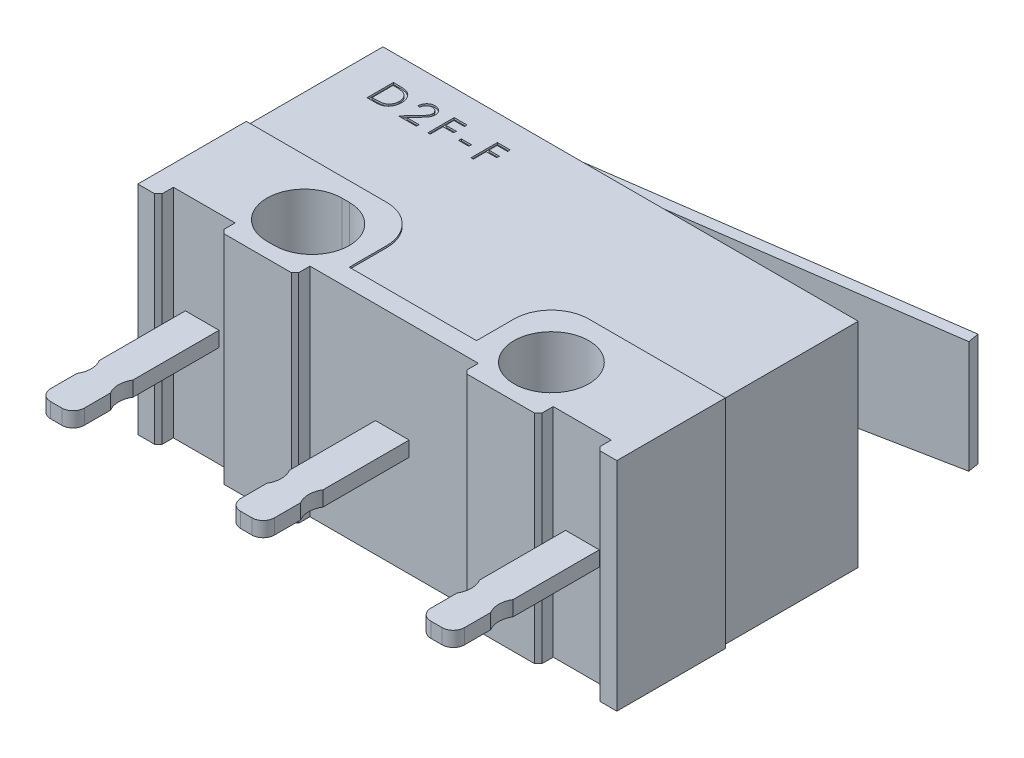
from build123d import *

# Parameters (mm, degrees)
SKETCH1_W                = 12.7
SKETCH1_H                = 6.1
BASE_EXTRUDE_DEPTH       = 5.7
SKETCH2_R                = 1
CUT_EXTRUDE1_DEPTH       = 16.198355174
BOSS_EXTRUDE1_START      = 0.05
SKETCH3_R                = 1
BOSS_EXTRUDE1_DEPTH      = 0.05
SKETCH4_R                = 1
BOSS_EXTRUDE2_DEPTH      = 0.05
SKETCH13_W               = 1.2
SKETCH13_H               = 2.9
EXTRUDE1_DEPTH           = 0.5
FILLET1_R                = 0.599
SKETCH6_W                = 0.9
SKETCH6_H                = 0.4
BOSS_EXTRUDE4_DEPTH      = 3.9
CUT_EXTRUDE4_DEPTH       = 15.644452875
FILLET2_R                = 0.3
SKETCH8_W                = 0.5
SKETCH8_H                = 5.8
SKETCH8_W_2              = 2
BOSS_EXTRUDE5_DEPTH      = 0.4
CHAMFER3_SIZE            = 0.1
BOSS_EXTRUDE6_DEPTH      = 1.8
BOSS_EXTRUDE6_DEPTH_BACK = 1.8
CUT_EXTRUDE5_DEPTH       = 18.718764616
SKETCH12_W               = 0.271367521
SKETCH12_H               = 0.072364672
CUT_EXTRUDE3_DEPTH       = 0.05
SKETCH16_W               = 2.901
SKETCH16_H               = 5.8
EXTRUDE2_DEPTH           = 0.05
SKETCH17_W               = 2.901
SKETCH17_H               = 5.8
EXTRUDE3_DEPTH           = 0.05
CUT_EXTRUDE6_DEPTH       = 0.3


with BuildPart() as part:
    # Sketch1 → Base-Extrude (new body)
    with BuildSketch(Plane(origin=(0, 0, 0), x_dir=(1, 0, 0), z_dir=(0, 1, 0))):
        with Locations((6.35, 3.05)):
            Rectangle(SKETCH1_W, SKETCH1_H)
    extrude(amount=BASE_EXTRUDE_DEPTH)

    # Sketch2 → Cut-Extrude1 (cut, through all)
    with BuildSketch(Plane(origin=(0, 5.7, 0), x_dir=(-1, 0, 0), z_dir=(0, 1, 0))):
        with Locations(Location((-9.6, -1.001, 0), (0, 0, 90))):
            Circle(SKETCH2_R)
        with BuildLine():
            Line((-3, -2.001), (-3.2, -2.001))
            ThreePointArc((-3.2, -2.001), (-4.2, -1.001), (-3.2, -0.001))
            Line((-3.2, -0.001), (-3, -0.001))
            ThreePointArc((-3, -0.001), (-2, -1.001), (-3, -2.001))
        make_face()
    extrude(amount=-CUT_EXTRUDE1_DEPTH, mode=Mode.SUBTRACT)

    # Sketch3 → Boss-Extrude1 (add)
    with BuildSketch(Plane(origin=(0, 5.7, 0), x_dir=(-1, 0, 0), z_dir=(0, 1, 0)).offset(BOSS_EXTRUDE1_START)):
        with BuildLine():
            Line((-12.7, -2.501), (-9.1, -2.501))
            ThreePointArc((-9.1, -2.501), (-8.392893219, -2.208106781), (-8.1, -1.501))
            Line((-8.1, -1.501), (-8.1, -0.5))
            Line((-8.1, -0.5), (-4.7, -0.5))
            Line((-4.7, -0.5), (-4.7, -1.501))
            ThreePointArc((-4.7, -1.501), (-4.407106781, -2.208106781), (-3.7, -2.501))
            Line((-3.7, -2.501), (0, -2.501))
            Line((0, -2.501), (0, 0))
            Line((0, 0), (-12.7, 0))
            Line((-12.7, 0), (-12.7, -2.501))
        make_face()
        with Locations(Location((-9.6, -1.001, 0), (0, 0, 90))):
            Circle(SKETCH3_R, mode=Mode.SUBTRACT)
        with BuildLine():
            Line((-3, -0.001), (-3.2, -0.001))
            ThreePointArc((-3.2, -0.001), (-4.2, -1.001), (-3.2, -2.001))
            Line((-3.2, -2.001), (-3, -2.001))
            ThreePointArc((-3, -2.001), (-2, -1.001), (-3, -0.001))
        make_face(mode=Mode.SUBTRACT)
    extrude(amount=-BOSS_EXTRUDE1_DEPTH)

    # Sketch4 → Boss-Extrude2 (add)
    with BuildSketch(Plane.XZ):
        with BuildLine():
            Line((12.7, -2.501), (12.7, 0))
            Line((12.7, 0), (0, 0))
            Line((0, 0), (0, -2.501))
            Line((0, -2.501), (3.7, -2.501))
            ThreePointArc((3.7, -2.501), (4.407106781, -2.208106781), (4.7, -1.501))
            Line((4.7, -1.501), (4.7, -0.5))
            Line((4.7, -0.5), (8.1, -0.5))
            Line((8.1, -0.5), (8.1, -1.501))
            ThreePointArc((8.1, -1.501), (8.392893219, -2.208106781), (9.1, -2.501))
            Line((9.1, -2.501), (12.7, -2.501))
        make_face()
        with Locations(Location((9.6, -1.001, 0), (0, 0, 90))):
            Circle(SKETCH4_R, mode=Mode.SUBTRACT)
        with BuildLine():
            Line((3, -0.001), (3.2, -0.001))
            ThreePointArc((3.2, -0.001), (4.2, -1.001), (3.2, -2.001))
            Line((3.2, -2.001), (3, -2.001))
            ThreePointArc((3, -2.001), (2, -1.001), (3, -0.001))
        make_face(mode=Mode.SUBTRACT)
    extrude(amount=BOSS_EXTRUDE2_DEPTH)

    # Sketch13 → Extrude1 (add)
    with BuildSketch(Plane(origin=(0, 0, -6.1), x_dir=(-1, 0, 0), z_dir=(0, 0, -1))):
        with Locations((-4.4, 2.85)):
            Rectangle(SKETCH13_W, SKETCH13_H)
    extrude(amount=EXTRUDE1_DEPTH)

    # Fillet1
    # the kernel refuses this fillet: 0.599 mm, written as the material it takes off along each edge
    with BuildSketch(Plane(origin=(3.8, 5.776905549, -6.6), x_dir=(0, 0, 1), z_dir=(0, -1, 0)), Plane(origin=(5, -0.076905549, -6.6), x_dir=(0, 0, 1), z_dir=(0, 1, 0))) as fillet1_piece_1:
        with BuildLine():
            CenterArc((0.599, -0.59076222), FILLET1_R, 99.513236816, 80.486763184)
            Line((0, -0.59076222), (-0.01198, -0.59076222))
            Line((-0.01198, -0.59076222), (-0.01198, 0))
            Line((-0.01198, 0), (0, 0.01198))
            ThreePointArc((0, 0.01198), (0.25, 0.01198), (0.49802, 0.011815244))
            Line((0.49802, 0.011815244), (0.5, 0))
        make_face()
    extrude(amount=5.853811098, mode=Mode.SUBTRACT)

    # Sketch6 → Boss-Extrude4 (add)
    with BuildSketch(Plane.XY):
        with Locations((1.27, 2.85)):
            Rectangle(SKETCH6_W, SKETCH6_H)
        with Locations((6.35, 2.85)):
            Rectangle(SKETCH6_W, SKETCH6_H)
        with Locations((11.43, 2.85)):
            Rectangle(SKETCH6_W, SKETCH6_H)
    extrude(amount=BOSS_EXTRUDE4_DEPTH)

    # Sketch14 → Cut-Extrude4 (cut, through all)
    with BuildSketch(Plane(origin=(0, 3.05, 0), x_dir=(-1, 0, 0), z_dir=(0, 1, 0))):
        with BuildLine():
            Line((-6.8, 2.3), (-6.8, 2.9))
            ThreePointArc((-6.8, 2.9), (-6.716904811, 2.6), (-6.8, 2.3))
        make_face()
        with BuildLine():
            Line((-5.9, 2.3), (-5.9, 2.9))
            ThreePointArc((-5.9, 2.9), (-5.983095189, 2.6), (-5.9, 2.3))
        make_face()
        with BuildLine():
            Line((-1.72, 2.3), (-1.72, 2.9))
            ThreePointArc((-1.72, 2.9), (-1.636904811, 2.6), (-1.72, 2.3))
        make_face()
        with BuildLine():
            Line((-0.82, 2.3), (-0.82, 2.9))
            ThreePointArc((-0.82, 2.9), (-0.903095189, 2.6), (-0.82, 2.3))
        make_face()
        with BuildLine():
            Line((-11.88, 2.3), (-11.88, 2.9))
            ThreePointArc((-11.88, 2.9), (-11.796904811, 2.6), (-11.88, 2.3))
        make_face()
        with BuildLine():
            Line((-10.98, 2.3), (-10.98, 2.9))
            ThreePointArc((-10.98, 2.9), (-11.063095189, 2.6), (-10.98, 2.3))
        make_face()
    extrude(amount=-CUT_EXTRUDE4_DEPTH, mode=Mode.SUBTRACT)

    # Fillet2
    fillet2_edges = [part.edges().sort_by_distance(p)[0] for p in [
        (0.82, 2.85, 3.9),
        (1.72, 2.85, 3.9),
        (5.9, 2.85, 3.9),
        (6.8, 2.85, 3.9),
        (10.98, 2.85, 3.9),
        (11.88, 2.85, 3.9),
    ]]
    fillet(fillet2_edges, radius=FILLET2_R)

    # Sketch8 → Boss-Extrude5 (add)
    with BuildSketch(Plane.XY):
        with Locations((12.45, 2.85)):
            Rectangle(SKETCH8_W, SKETCH8_H)
        with Locations((0.25, 2.85)):
            Rectangle(SKETCH8_W, SKETCH8_H)
        with Locations((3.15, 2.85)):
            Rectangle(SKETCH8_W_2, SKETCH8_H)
        with Locations((9.65, 2.85)):
            Rectangle(SKETCH8_W_2, SKETCH8_H)
    extrude(amount=BOSS_EXTRUDE5_DEPTH)

    # Chamfer3
    chamfer3_edges = [part.edges().sort_by_distance(p)[0] for p in [
        (0.5, 2.85, 0.4),
        (12.2, 2.85, 0.4),
        (2.15, 2.85, 0.4),
        (4.15, 2.85, 0.4),
        (8.65, 2.85, 0.4),
        (10.65, 2.85, 0.4),
    ]]
    chamfer(chamfer3_edges, length=CHAMFER3_SIZE)

    # Sketch11 → Boss-Extrude6 (add, two sides: drawn at the far end of the back side and taken through both)
    with BuildSketch(Plane(origin=(0, 3, 0), x_dir=(-1, 0, 0), z_dir=(0, 1, 0)).offset(-BOSS_EXTRUDE6_DEPTH_BACK)):
        with BuildLine():
            Line((-13.4, -8.6), (-1.150385897, -6.545868959))
            ThreePointArc((-1.150385897, -6.545868959), (-0.970997565, -6.443798567), (-0.9, -6.25))
            Line((-0.9, -6.25), (-0.9, -6.1))
            Line((-0.9, -6.1), (-1.2, -6.1))
            Line((-1.2, -6.1), (-1.2, -6.165372705))
            ThreePointArc((-1.2, -6.165372705), (-1.223665855, -6.229972227), (-1.283461966, -6.263995691))
            Line((-1.283461966, -6.263995691), (-13.449614103, -8.304131041))
            Line((-13.449614103, -8.304131041), (-13.4, -8.6))
        make_face()
    extrude(amount=BOSS_EXTRUDE6_DEPTH + BOSS_EXTRUDE6_DEPTH_BACK)

    # Sketch15 → Cut-Extrude5 (cut, through all)
    with BuildSketch(Plane(origin=(0, 0, -6.1), x_dir=(-1, 0, 0), z_dir=(0, 0, -1))):
        Polygon((-0.9, 1.2), (-13.449614103, 1.2), (-13.449614103, 1.5), align=None)
        Polygon((-13.449614103, 4.5), (-13.449614103, 4.8), (-0.9, 4.8), align=None)
    extrude(amount=CUT_EXTRUDE5_DEPTH, mode=Mode.SUBTRACT)

    # Sketch12 → Cut-Extrude3 (cut)
    # profile 1 of 5: a face of its own
    with BuildSketch(Plane(origin=(-12.497117176, 5.7, -3.291404599), x_dir=(1, 0, 0), z_dir=(0, 1, 0))):
        with BuildLine():
            Line((13.462569321, 1.417389307), (13.462569321, 2.122944862))
            Line((13.462569321, 2.122944862), (13.60503727, 2.122944862))
            add(Edge.make_bspline(
                [(13.60503727, 2.122944862), (13.617428637, 2.122855646), (13.641368695, 2.12268328), (13.675963585, 2.121590397), (13.707972375, 2.11965708), (13.737289793, 2.116841001), (13.763996323, 2.113383168), (13.788017185, 2.109048959), (13.809476585, 2.103931026), (13.822674393, 2.099567578), (13.828915475, 2.097504157)],
                knots=[0, 0, 0, 0, 1.314313732, 2.53924729, 3.670748893, 4.714932338, 5.66265055, 6.526160246, 7.303039223, 8, 8, 8, 8], degree=3))
            add(Edge.make_bspline(
                [(13.828915475, 2.097504157), (13.8370787, 2.094393523), (13.853220036, 2.088242793), (13.876202424, 2.076640174), (13.897837854, 2.063494041), (13.918242349, 2.048787065), (13.936949817, 2.032102823), (13.954691091, 2.014150046), (13.970740409, 1.994275888), (13.985437795, 1.972892518), (13.998689269, 1.950251834), (14.010207798, 1.926396979), (14.019773921, 1.901449097), (14.027715095, 1.875477568), (14.033973666, 1.848425282), (14.038243675, 1.820260741), (14.041060049, 1.791095253), (14.041343088, 1.771304528), (14.0414867, 1.761262838)],
                knots=[0, 0, 0, 0, 0.984719456, 1.947108742, 2.898477687, 3.838006223, 4.779231079, 5.722358779, 6.681677486, 7.655904652, 8.64651281, 9.637519902, 10.640069247, 11.656948941, 12.698408672, 13.768548281, 14.867775369, 16, 16, 16, 16], degree=3))
            add(Edge.make_bspline(
                [(14.0414867, 1.761262838), (14.041359908, 1.752541922), (14.041110052, 1.735356445), (14.038866523, 1.710028836), (14.035605582, 1.685452608), (14.03055699, 1.661744792), (14.024428229, 1.638697675), (14.016573551, 1.61655689), (14.007575602, 1.595119328), (13.997083007, 1.574674853), (13.98556403, 1.555305665), (13.973202345, 1.537046789), (13.960011138, 1.520158768), (13.945864622, 1.50459046), (13.930945606, 1.490365336), (13.915156415, 1.477364564), (13.898456308, 1.465842529), (13.880920083, 1.455346461), (13.862036165, 1.446190294), (13.841446871, 1.438443292), (13.819064396, 1.432023419), (13.794943678, 1.426667064), (13.76904304, 1.422418147), (13.74133709, 1.419570446), (13.711868395, 1.417644696), (13.69163321, 1.417476089), (13.681218048, 1.417389307)],
                knots=[0, 0, 0, 0, 1.105936401, 2.179363191, 3.223086493, 4.248585256, 5.251745608, 6.245858792, 7.225916811, 8.198733463, 9.158002045, 10.082870192, 10.993790845, 11.873723703, 12.748670949, 13.606408763, 14.465103618, 15.319838547, 16.196477973, 17.123216899, 18.106603292, 19.147568657, 20.255746949, 21.433717677, 22.679120308, 24, 24, 24, 24], degree=3))
            Line((13.681218048, 1.417389307), (13.462569321, 1.417389307))
        make_face()
        with BuildLine():
            Line((13.525888409, 1.489753979), (13.606874654, 1.489753979))
            add(Edge.make_bspline(
                [(13.606874654, 1.489753979), (13.618511961, 1.489803992), (13.640894763, 1.489900186), (13.673079788, 1.490744273), (13.702487222, 1.492123521), (13.72912124, 1.494053735), (13.752966805, 1.496607567), (13.774073752, 1.499454968), (13.792372891, 1.50300239), (13.803445968, 1.506217901), (13.808562911, 1.50770381)],
                knots=[0, 0, 0, 0, 1.375205317, 2.645023457, 3.804390687, 4.853969522, 5.800190428, 6.637939096, 7.370582563, 8, 8, 8, 8], degree=3))
            add(Edge.make_bspline(
                [(13.808562911, 1.50770381), (13.815003295, 1.509971981), (13.827730235, 1.514454149), (13.846050708, 1.522630058), (13.863136643, 1.532314729), (13.879285807, 1.54307995), (13.894269117, 1.555305414), (13.908264137, 1.56872528), (13.921242691, 1.583407845), (13.933070686, 1.599334887), (13.943655694, 1.616407275), (13.952822116, 1.634457167), (13.960855679, 1.653286793), (13.967161046, 1.673185306), (13.972103076, 1.693974815), (13.975603577, 1.715656782), (13.977783688, 1.738227158), (13.97803798, 1.753578459), (13.978167612, 1.761404175)],
                knots=[0, 0, 0, 0, 0.998632004, 1.973411704, 2.929992603, 3.868527914, 4.809262121, 5.754881198, 6.702106254, 7.672490631, 8.653608572, 9.636854334, 10.631411391, 11.644891563, 12.686317036, 13.754757253, 14.855430412, 16, 16, 16, 16], degree=3))
            add(Edge.make_bspline(
                [(13.978167612, 1.761404175), (13.97806414, 1.769655845), (13.977860867, 1.785866323), (13.975305887, 1.809651749), (13.971572177, 1.832528007), (13.966172926, 1.854496628), (13.959292574, 1.87560047), (13.950706035, 1.895722816), (13.940895463, 1.915076178), (13.929222885, 1.933213868), (13.916439107, 1.950367558), (13.90225182, 1.966082279), (13.886886425, 1.980393829), (13.870510511, 1.993525087), (13.852662556, 2.004947764), (13.833763003, 2.015165556), (13.81353459, 2.023837013), (13.799461237, 2.028449101), (13.792309127, 2.030792975)],
                knots=[0, 0, 0, 0, 1.122418816, 2.205001699, 3.251619955, 4.274784885, 5.280384055, 6.268708349, 7.249350384, 8.229342522, 9.199999885, 10.157847722, 11.105861043, 12.055065948, 13.010012805, 13.98527497, 14.976112212, 16, 16, 16, 16], degree=3))
            add(Edge.make_bspline(
                [(13.792309127, 2.030792975), (13.786392309, 2.032429144), (13.773811529, 2.035908088), (13.753281987, 2.039703044), (13.730177028, 2.0430503), (13.704394072, 2.045884222), (13.67596251, 2.047917698), (13.644860474, 2.049443979), (13.611074522, 2.050473411), (13.587653599, 2.050543706), (13.575497784, 2.05058019)],
                knots=[0, 0, 0, 0, 0.674548936, 1.434276114, 2.292660221, 3.240891867, 4.284742987, 5.42552168, 6.663806718, 8, 8, 8, 8], degree=3))
            Line((13.575497784, 2.05058019), (13.525888409, 2.05058019))
            Line((13.525888409, 2.05058019), (13.525888409, 1.489753979))
        make_face(mode=Mode.SUBTRACT)
    # profile 2 of 5: a face of its own
    with BuildSketch(Plane(origin=(-12.497117176, 5.7, -3.291404599), x_dir=(1, 0, 0), z_dir=(0, 1, 0))):
        with BuildLine():
            Line((14.392455361, 1.905850845), (14.329136273, 1.905850845))
            add(Edge.make_bspline(
                [(14.329136273, 1.905850845), (14.329548953, 1.914251167), (14.330359445, 1.930749176), (14.334154989, 1.95480336), (14.339585928, 1.977795359), (14.347264682, 1.999540564), (14.356801026, 2.020231244), (14.36823708, 2.039785216), (14.381782507, 2.058127884), (14.397144817, 2.075089206), (14.413829923, 2.09064924), (14.431832866, 2.104086091), (14.450750832, 2.115439018), (14.470526425, 2.124929999), (14.491382761, 2.132054063), (14.513130575, 2.137340012), (14.535865417, 2.140520323), (14.55135539, 2.140862172), (14.559233317, 2.141036031)],
                knots=[0, 0, 0, 0, 1.10065271, 2.161652631, 3.183658789, 4.190468796, 5.17591951, 6.163126047, 7.15150782, 8.156236427, 9.156009102, 10.134482811, 11.092018607, 12.041330605, 13.001268258, 13.972401359, 14.968799086, 16, 16, 16, 16], degree=3))
            add(Edge.make_bspline(
                [(14.559233317, 2.141036031), (14.566969849, 2.140854913), (14.582171859, 2.140499024), (14.604358964, 2.137442753), (14.625480736, 2.132655943), (14.645495889, 2.125939978), (14.66424473, 2.116912006), (14.681868106, 2.106067106), (14.698575825, 2.093524378), (14.713615605, 2.078757339), (14.727425964, 2.062992732), (14.739340228, 2.04616263), (14.749543199, 2.028779901), (14.7580477, 2.010711994), (14.764308223, 1.991788787), (14.76906129, 1.972285779), (14.771747928, 1.952001095), (14.772160259, 1.938271678), (14.772369891, 1.93129155)],
                knots=[0, 0, 0, 0, 1.111607364, 2.184268762, 3.212621178, 4.221274766, 5.211760367, 6.196651075, 7.1921475, 8.207485113, 9.220403448, 10.201281604, 11.166441695, 12.114753415, 13.065576456, 14.026450734, 14.996634279, 16, 16, 16, 16], degree=3))
            add(Edge.make_bspline(
                [(14.772369891, 1.93129155), (14.772028551, 1.921464606), (14.77135186, 1.901983166), (14.765563406, 1.873354773), (14.756522919, 1.845617687), (14.745637738, 1.823294453), (14.734656785, 1.805306114), (14.724761367, 1.790495756), (14.71317719, 1.774549098), (14.699735652, 1.75751954), (14.684714803, 1.73927369), (14.667978589, 1.719822573), (14.649407665, 1.699367153), (14.636373332, 1.685396024), (14.629619268, 1.678156534)],
                knots=[0, 0, 0, 0, 1.184426356, 2.348067706, 3.509069118, 4.696110526, 5.333549288, 6.050745305, 6.844228056, 7.710549037, 8.667450064, 9.695053472, 10.805634456, 12, 12, 12, 12], degree=3))
            Line((14.629619268, 1.678156534), (14.453089042, 1.489753979))
            Line((14.453089042, 1.489753979), (14.781415475, 1.489753979))
            Line((14.781415475, 1.489753979), (14.781415475, 1.417389307))
            Line((14.781415475, 1.417389307), (14.301999521, 1.417389307))
            Line((14.301999521, 1.417389307), (14.575628438, 1.709392067))
            add(Edge.make_bspline(
                [(14.575628438, 1.709392067), (14.582290472, 1.716346487), (14.595086877, 1.729704506), (14.613185904, 1.749206658), (14.6294417, 1.767299026), (14.643959492, 1.783947425), (14.656424342, 1.799395376), (14.667485887, 1.813142563), (14.676348792, 1.825793063), (14.68596761, 1.840456647), (14.695283761, 1.858360082), (14.703289268, 1.880239096), (14.708170674, 1.902761891), (14.708756252, 1.917982143), (14.709050803, 1.92563806)],
                knots=[0, 0, 0, 0, 1.329631726, 2.553950428, 3.673215718, 4.687767853, 5.603093632, 6.413772471, 7.123043292, 7.734684054, 8.834405432, 9.900288307, 10.943827018, 12, 12, 12, 12], degree=3))
            add(Edge.make_bspline(
                [(14.709050803, 1.92563806), (14.708922645, 1.930452247), (14.708670071, 1.939940085), (14.70644098, 1.953850769), (14.703072354, 1.967269391), (14.698245294, 1.980237223), (14.691873776, 1.992623886), (14.684118032, 2.004444458), (14.675169559, 2.015872233), (14.664817795, 2.026587263), (14.653445949, 2.036400776), (14.641432505, 2.045094044), (14.628722404, 2.052359071), (14.615369237, 2.058314665), (14.601410229, 2.062986528), (14.586818384, 2.066223733), (14.571634019, 2.068256234), (14.561265679, 2.068531234), (14.55598256, 2.068671358)],
                knots=[0, 0, 0, 0, 0.991446411, 1.95395049, 2.89581595, 3.838931463, 4.798493298, 5.75982156, 6.748411868, 7.785213223, 8.824556874, 9.840280684, 10.836137867, 11.835679398, 12.848801643, 13.863922112, 14.911575587, 16, 16, 16, 16], degree=3))
            add(Edge.make_bspline(
                [(14.55598256, 2.068671358), (14.550464948, 2.068527217), (14.539629268, 2.068244147), (14.523720193, 2.066264022), (14.508543537, 2.062847956), (14.494061121, 2.058175833), (14.480248443, 2.052237364), (14.467172675, 2.044840774), (14.454863172, 2.036014578), (14.443296794, 2.026007672), (14.432640087, 2.014866425), (14.423276986, 2.002446639), (14.415095764, 1.988975081), (14.407957713, 1.9744881), (14.402160931, 1.958854243), (14.397731423, 1.942129007), (14.394226455, 1.924385014), (14.393055531, 1.912131513), (14.392455361, 1.905850845)],
                knots=[0, 0, 0, 0, 1.031018746, 2.02475058, 2.990194455, 3.934040569, 4.864654155, 5.795059489, 6.735614925, 7.690564532, 8.649604399, 9.611025574, 10.590972636, 11.591080095, 12.624614302, 13.701020113, 14.821632451, 16, 16, 16, 16], degree=3))
        make_face()
    # profile 3 of 5: a face of its own
    with BuildSketch(Plane(origin=(-12.497117176, 5.7, -3.291404599), x_dir=(1, 0, 0), z_dir=(0, 1, 0))):
        Polygon((15.087156216, 2.122944862), (15.430888409, 2.122944862), (15.430888409, 2.05058019), (15.150475304, 2.05058019), (15.150475304, 1.833486173), (15.430888409, 1.833486173), (15.430888409, 1.761121501), (15.150475304, 1.761121501), (15.150475304, 1.417389307), (15.087156216, 1.417389307), align=None)
    # profile 4 of 5: a face of its own
    with BuildSketch(Plane(origin=(-12.497117176, 5.7, -3.291404599), x_dir=(1, 0, 0), z_dir=(0, 1, 0))):
        with Locations((15.808993822, 1.688756828)):
            Rectangle(SKETCH12_W, SKETCH12_H)
    # profile 5 of 5: a face of its own
    with BuildSketch(Plane(origin=(-12.497117176, 5.7, -3.291404599), x_dir=(1, 0, 0), z_dir=(0, 1, 0))):
        Polygon((16.24137274, 2.122944862), (16.585104934, 2.122944862), (16.585104934, 2.05058019), (16.304691828, 2.05058019), (16.304691828, 1.833486173), (16.585104934, 1.833486173), (16.585104934, 1.761121501), (16.304691828, 1.761121501), (16.304691828, 1.417389307), (16.24137274, 1.417389307), align=None)
    extrude(amount=-CUT_EXTRUDE3_DEPTH, mode=Mode.SUBTRACT)

    # Sketch16 → Extrude2 (add)
    with BuildSketch(Plane(origin=(12.7, 0, 0), x_dir=(0, 0, -1), z_dir=(1, 0, 0))):
        with Locations((1.0505, 2.85)):
            Rectangle(SKETCH16_W, SKETCH16_H)
    extrude(amount=EXTRUDE2_DEPTH)

    # Sketch17 → Extrude3 (add)
    with BuildSketch(Plane.ZY):
        with Locations((-1.0505, 2.85)):
            Rectangle(SKETCH17_W, SKETCH17_H)
    extrude(amount=EXTRUDE3_DEPTH)

    # Sketch19 → Cut-Extrude6 (cut)
    with BuildSketch(Plane(origin=(-1.036187266, 0, -6.17920371), x_dir=(-0.9862298628299674, 0, 0.16538034243036254), z_dir=(-0.16538034243036254, 0, -0.9862298628299674))):
        with BuildLine():
            Line((-1.921234017, 2.25), (-7.331947077, 2.500535144))
            ThreePointArc((-7.331947077, 2.500535144), (-7.808820089, 3), (-7.331947077, 3.499464856))
            Line((-7.331947077, 3.499464856), (-1.921234017, 3.75))
            Line((-1.921234017, 3.75), (-1.921234017, 2.25))
        make_face()
    extrude(amount=-CUT_EXTRUDE6_DEPTH, mode=Mode.SUBTRACT)


solid = part.part
